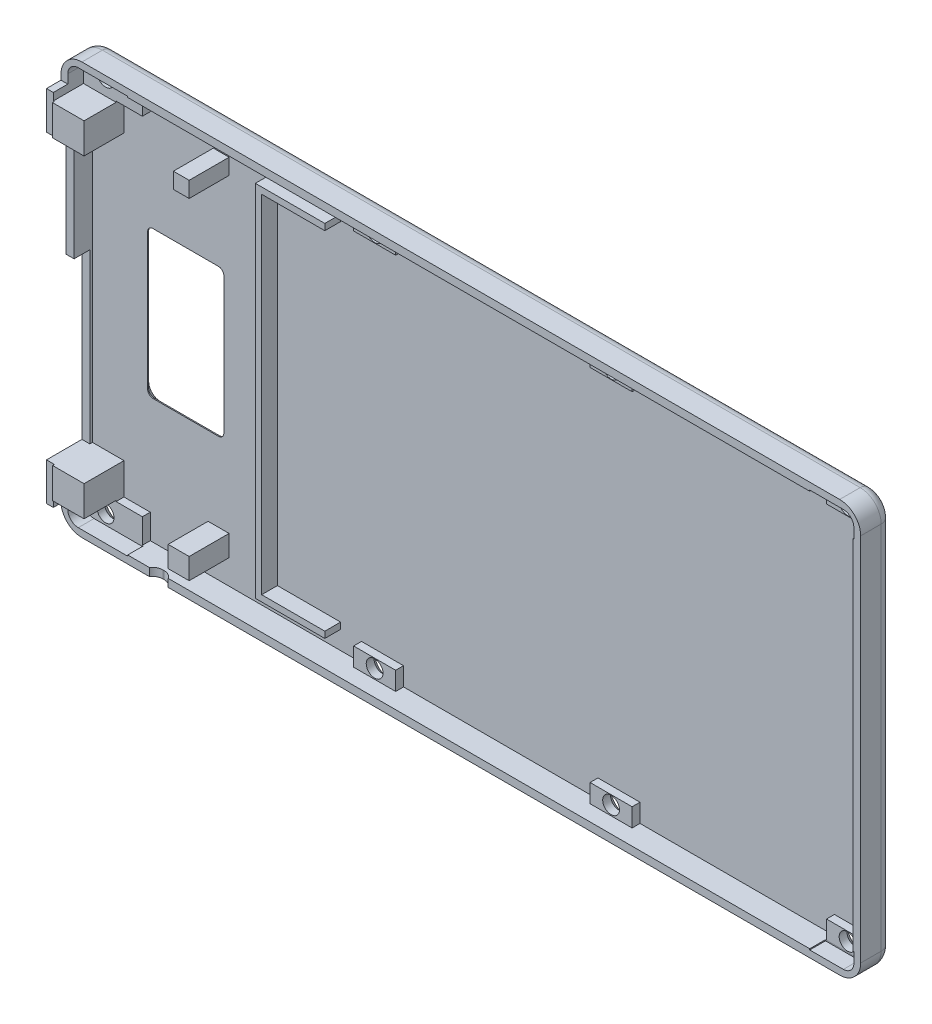
from build123d import *

# Parameters (mm, degrees)
BOSS_EXTRU_1_DEPTH            = 5.9
ESQUISSE1_4_W                 = 149.2
ESQUISSE1_4_H                 = 75.4
BOSS_EXTRU_2_DEPTH            = 1.4
BOSS_EXTRU_5_START            = 1.4
ESQUISSE1_5_W                 = 8
ESQUISSE1_5_H                 = 3.5
ESQUISSE1_5_R                 = 1.25
BOSS_EXTRU_5_DEPTH            = 1.5
BOSS_EXTRU_5_2_DEPTH          = 1.5
BOSS_EXTRU_5_3_DEPTH          = 1.5
BOSS_EXTRU_5_4_DEPTH          = 1.5
BOSS_EXTRU_5_5_DEPTH          = 1.5
BOSS_EXTRU_5_6_DEPTH          = 1.5
BOSS_EXTRU_7_START            = 1.4
BOSS_EXTRU_7_DEPTH            = 3
CONG_1_R                      = 4
CONG_2_R                      = 2
ENL_V_MAT_EXTRU_2_DEPTH       = 4.3
ENL_V_MAT_EXTRU_2_DEPTH_BACK  = 60.5
ESQUISSE4_R                   = 1.6
BOSS_EXTRU_9_START            = 1.4
ESQUISSE1_9_W                 = 6
ESQUISSE1_9_H                 = 6
ESQUISSE1_9_W_2               = 4
ESQUISSE1_9_H_2               = 4
ESQUISSE1_9_W_3               = 3
ESQUISSE1_9_H_3               = 3
BOSS_EXTRU_9_DEPTH            = 7.6
ESQUISSE5_W                   = 11
ESQUISSE5_H                   = 4.7
BOSS_EXTRU_10_DEPTH           = 1.5
ESQUISSE6_R                   = 1.6
ENL_V_MAT_EXTRU_3_DEPTH       = 40
CHANFREIN3_SIZE               = 1.48
ENL_V_MAT_EXTRU_6_DEPTH       = 1.4
ENL_V_MAT_EXTRU_7_DEPTH       = 3
CHANFREIN4_SIZE               = 1.2
CONG_3_R                      = 2
ESQUISSE11_W                  = 1.5
ESQUISSE11_H                  = 7.2
BOSS_EXTRU_11_DEPTH           = 2.75
ESQUISSE12_W                  = 1.5
ESQUISSE12_H                  = 32
ENL_V_MAT_EXTRU_8_DEPTH       = 4
ESQUISSE13_W                  = 1.5
ESQUISSE13_H                  = 22
ENL_V_MAT_EXTRU_9_DEPTH       = 1
ESQUISSE16_W                  = 101.979164715
ESQUISSE16_H                  = 1.2
ENL_V_MAT_EXTRU_11_DEPTH      = 3
ENL_V_MAT_EXTRU_10_DEPTH      = 5.7
ENL_V_MAT_EXTRU_10_DEPTH_BACK = 5.75


with BuildPart() as part:
    # Esquisse1 → Boss.-Extru.1 (new body)
    with BuildSketch(Plane.XY):
        Polygon((149.2, 75.4), (149.2, 71.9), (149.2, 70.7), (149.2, 37.7), (150.7, 37.7), (150.7, 76.9), (-1.5, 76.9), (-1.5, 37.7), (0, 37.7), (0, 64.7), (0, 70.7), (0, 72.1), (0, 75.4), (51.2, 75.4), (59.2, 75.4), (96.2, 75.4), (104.2, 75.4), (141.2, 75.4), align=None)
        Polygon((150.7, 37.7), (149.2, 37.7), (149.2, 4.7), (149.2, 3.5), (149.2, 0), (141.2, 0), (104.2, 0), (96.2, 0), (59.2, 0), (51.2, 0), (0, 0), (0, 3.3), (0, 4.7), (0, 10.7), (0, 37.7), (-1.5, 37.7), (-1.5, -1.5), (150.7, -1.5), align=None)
    extrude(amount=BOSS_EXTRU_1_DEPTH)

    # Esquisse1<4> → Boss.-Extru.2 (add)
    with BuildSketch(Plane.XY):
        with Locations((74.6, 37.7)):
            Rectangle(ESQUISSE1_4_W, ESQUISSE1_4_H)
    extrude(amount=BOSS_EXTRU_2_DEPTH)

    # Esquisse1<6> → Boss.-Extru.7 (add)
    with BuildSketch(Plane.XY.offset(BOSS_EXTRU_7_START)):
        Polygon((149.2, 70.7), (149.2, 71.9), (141.2, 71.9), (104.2, 71.9), (96.2, 71.9), (59.2, 71.9), (51.2, 71.9), (34, 71.9), (34, 37.7), (35.2, 37.7), (35.2, 70.7), align=None)
        Polygon((149.2, 3.5), (149.2, 4.7), (35.2, 4.7), (35.2, 37.7), (34, 37.7), (34, 3.5), (51.2, 3.5), (59.2, 3.5), (96.2, 3.5), (104.2, 3.5), (141.2, 3.5), align=None)
    extrude(amount=BOSS_EXTRU_7_DEPTH)

    # Congé1
    cong_1_edges = [part.edges().sort_by_distance(p)[0] for p in [
        (-1.5, 76.9, 2.95),
        (150.7, 76.9, 2.95),
        (150.7, -1.5, 2.95),
        (-1.5, -1.5, 2.95),
    ]]
    fillet(cong_1_edges, radius=CONG_1_R)

    # Congé2
    cong_2_edges = [part.edges().sort_by_distance(p)[0] for p in [
        (149.2, 0, 3.65),
        (149.2, 75.4, 3.65),
        (0, 75.4, 3.65),
        (0, 0, 3.65),
    ]]
    fillet(cong_2_edges, radius=CONG_2_R)


with BuildPart() as body_2:
    # Esquisse1<5> → Boss.-Extru.5 (new body)
    with BuildSketch(Plane.XY.offset(BOSS_EXTRU_5_START)):
        with Locations((145.2, 73.65)):
            Rectangle(ESQUISSE1_5_W, ESQUISSE1_5_H)
        with Locations(Location((145.2, 73.6, 0), (0, 0, 180))):
            Circle(ESQUISSE1_5_R, mode=Mode.SUBTRACT)
    extrude(amount=BOSS_EXTRU_5_DEPTH)


with BuildPart() as body_3:
    # Esquisse1<5> → Boss.-Extru.5 2 (new body)
    with BuildSketch(Plane.XY.offset(BOSS_EXTRU_5_START)):
        with Locations((100.2, 73.65)):
            Rectangle(ESQUISSE1_5_W, ESQUISSE1_5_H)
        with Locations(Location((100.2, 73.6, 0), (0, 0, 180))):
            Circle(ESQUISSE1_5_R, mode=Mode.SUBTRACT)
    extrude(amount=BOSS_EXTRU_5_2_DEPTH)


with BuildPart() as body_4:
    # Esquisse1<5> → Boss.-Extru.5 3 (new body)
    with BuildSketch(Plane.XY.offset(BOSS_EXTRU_5_START)):
        with Locations((145.2, 1.75)):
            Rectangle(ESQUISSE1_5_W, ESQUISSE1_5_H)
        with Locations(Location((145.2, 1.8, 0), (0, 0, 180))):
            Circle(ESQUISSE1_5_R, mode=Mode.SUBTRACT)
    extrude(amount=BOSS_EXTRU_5_3_DEPTH)


with BuildPart() as body_5:
    # Esquisse1<5> → Boss.-Extru.5 4 (new body)
    with BuildSketch(Plane.XY.offset(BOSS_EXTRU_5_START)):
        with Locations((55.2, 73.65)):
            Rectangle(ESQUISSE1_5_W, ESQUISSE1_5_H)
        with Locations(Location((55.2, 73.6, 0), (0, 0, 180))):
            Circle(ESQUISSE1_5_R, mode=Mode.SUBTRACT)
    extrude(amount=BOSS_EXTRU_5_4_DEPTH)


with BuildPart() as body_6:
    # Esquisse1<5> → Boss.-Extru.5 5 (new body)
    with BuildSketch(Plane.XY.offset(BOSS_EXTRU_5_START)):
        with Locations((100.2, 1.75)):
            Rectangle(ESQUISSE1_5_W, ESQUISSE1_5_H)
        with Locations(Location((100.2, 1.8, 0), (0, 0, 180))):
            Circle(ESQUISSE1_5_R, mode=Mode.SUBTRACT)
    extrude(amount=BOSS_EXTRU_5_5_DEPTH)


with BuildPart() as body_7:
    # Esquisse1<5> → Boss.-Extru.5 6 (new body)
    with BuildSketch(Plane.XY.offset(BOSS_EXTRU_5_START)):
        with Locations((55.2, 1.75)):
            Rectangle(ESQUISSE1_5_W, ESQUISSE1_5_H)
        with Locations(Location((55.2, 1.8, 0), (0, 0, 180))):
            Circle(ESQUISSE1_5_R, mode=Mode.SUBTRACT)
    extrude(amount=BOSS_EXTRU_5_6_DEPTH)


with BuildPart() as enl_v_mat_extru_2_tool:
    # Esquisse4 → Enlèv. mat.-Extru.2 (new, two sides: drawn at the far end of the back side and taken through both)
    with BuildSketch(Plane(origin=(0, 0, 0), x_dir=(-1, 0, 0), z_dir=(0, 0, -1)).offset(-ENL_V_MAT_EXTRU_2_DEPTH_BACK)):
        with Locations(Location((-55.2, 1.8, 0), (0, 0, 180))):
            Circle(ESQUISSE4_R)
        with Locations(Location((-100.2, 1.8, 0), (0, 0, 180))):
            Circle(ESQUISSE4_R)
        with Locations(Location((-145.2, 1.8, 0), (0, 0, 180))):
            Circle(ESQUISSE4_R)
        with Locations(Location((-145.2, 73.6, 0), (0, 0, 180))):
            Circle(ESQUISSE4_R)
        with Locations(Location((-100.2, 73.6, 0), (0, 0, 180))):
            Circle(ESQUISSE4_R)
        with Locations(Location((-55.2, 73.6, 0), (0, 0, 180))):
            Circle(ESQUISSE4_R)
    extrude(amount=ENL_V_MAT_EXTRU_2_DEPTH + ENL_V_MAT_EXTRU_2_DEPTH_BACK)


with BuildPart() as part_1:
    add(part.part)

    # Enlèv. mat.-Extru.2: cut by enl_v_mat_extru_2_tool
    add(enl_v_mat_extru_2_tool.part, mode=Mode.SUBTRACT)

    # Esquisse1<9> → Boss.-Extru.9 (add)
    with BuildSketch(Plane.XY.offset(BOSS_EXTRU_9_START)):
        with Locations((3, 7.7)):
            Rectangle(ESQUISSE1_9_W, ESQUISSE1_9_H)
        with Locations((24, 6.7)):
            Rectangle(ESQUISSE1_9_W_2, ESQUISSE1_9_H_2)
        with Locations((3, 67.7)):
            Rectangle(ESQUISSE1_9_W, ESQUISSE1_9_H)
        with Locations((24.5, 69.2)):
            Rectangle(ESQUISSE1_9_W_3, ESQUISSE1_9_H_3)
    extrude(amount=BOSS_EXTRU_9_DEPTH)

    # Esquisse5 → Boss.-Extru.10 (add)
    with BuildSketch(Plane.XY.offset(1.4)):
        with Locations((5.5, 73.05)):
            Rectangle(ESQUISSE5_W, ESQUISSE5_H)
        with Locations((5.5, 2.35)):
            Rectangle(ESQUISSE5_W, ESQUISSE5_H)
    extrude(amount=BOSS_EXTRU_10_DEPTH)

    # Esquisse6 → Enlèv. mat.-Extru.3 (cut)
    with BuildSketch(Plane(origin=(0, 0, 0), x_dir=(-1, 0, 0), z_dir=(0, 0, -1))):
        with Locations((-4, 1.8)):
            Circle(ESQUISSE6_R)
        with Locations((-4, 73.6)):
            Circle(ESQUISSE6_R)
    extrude(amount=-ENL_V_MAT_EXTRU_3_DEPTH, mode=Mode.SUBTRACT)

    # Chanfrein3
    # the kernel refuses this chamfer: 1.48 mm, written as the material it takes off along each edge
    with BuildSketch(Plane(origin=(55.2, 1.8, 0), x_dir=(1, 0, 0), z_dir=(0, 1, 0))) as chanfrein3_piece_1:
        Polygon((1.6 + CHANFREIN3_SIZE, 0), (1.6, -CHANFREIN3_SIZE), (1.6, 0), align=None)
    revolve(axis=Axis((55.2, 1.8, 0), (0, 0, -1)), mode=Mode.SUBTRACT)
    with BuildSketch(Plane(origin=(100.2, 1.8, 0), x_dir=(1, 0, 0), z_dir=(0, 1, 0))) as chanfrein3_piece_2:
        Polygon((1.6 + CHANFREIN3_SIZE, 0), (1.6, -CHANFREIN3_SIZE), (1.6, 0), align=None)
    revolve(axis=Axis((100.2, 1.8, 0), (0, 0, -1)), mode=Mode.SUBTRACT)
    with BuildSketch(Plane(origin=(145.2, 1.8, 0), x_dir=(1, 0, 0), z_dir=(0, 1, 0))) as chanfrein3_piece_3:
        Polygon((1.6 + CHANFREIN3_SIZE, 0), (1.6, -CHANFREIN3_SIZE), (1.6, 0), align=None)
    revolve(axis=Axis((145.2, 1.8, 0), (0, 0, -1)), mode=Mode.SUBTRACT)
    with BuildSketch(Plane(origin=(145.2, 73.6, 0), x_dir=(1, 0, 0), z_dir=(0, 1, 0))) as chanfrein3_piece_4:
        Polygon((1.6 + CHANFREIN3_SIZE, 0), (1.6, -CHANFREIN3_SIZE), (1.6, 0), align=None)
    revolve(axis=Axis((145.2, 73.6, 0), (0, 0, -1)), mode=Mode.SUBTRACT)
    with BuildSketch(Plane(origin=(100.2, 73.6, 0), x_dir=(1, 0, 0), z_dir=(0, 1, 0))) as chanfrein3_piece_5:
        Polygon((1.6 + CHANFREIN3_SIZE, 0), (1.6, -CHANFREIN3_SIZE), (1.6, 0), align=None)
    revolve(axis=Axis((100.2, 73.6, 0), (0, 0, -1)), mode=Mode.SUBTRACT)
    with BuildSketch(Plane(origin=(55.2, 73.6, 0), x_dir=(1, 0, 0), z_dir=(0, 1, 0))) as chanfrein3_piece_6:
        Polygon((1.6 + CHANFREIN3_SIZE, 0), (1.6, -CHANFREIN3_SIZE), (1.6, 0), align=None)
    revolve(axis=Axis((55.2, 73.6, 0), (0, 0, -1)), mode=Mode.SUBTRACT)
    with BuildSketch(Plane(origin=(4, 1.8, 0), x_dir=(-1, 0, 0), z_dir=(0, -1, 0))) as chanfrein3_piece_7:
        Polygon((1.6 + CHANFREIN3_SIZE, 0), (1.6, -CHANFREIN3_SIZE), (1.6, 0), align=None)
    revolve(axis=Axis((4, 1.8, 0), (0, 0, -1)), mode=Mode.SUBTRACT)
    with BuildSketch(Plane(origin=(4, 73.6, 0), x_dir=(-1, 0, 0), z_dir=(0, -1, 0))) as chanfrein3_piece_8:
        Polygon((1.6 + CHANFREIN3_SIZE, 0), (1.6, -CHANFREIN3_SIZE), (1.6, 0), align=None)
    revolve(axis=Axis((4, 73.6, 0), (0, 0, -1)), mode=Mode.SUBTRACT)

    # Esquisse9 → Enlèv. mat.-Extru.6 (cut)
    with BuildSketch(Plane(origin=(0, 0, 0), x_dir=(-1, 0, 0), z_dir=(0, 0, -1))):
        with BuildLine():
            Line((-11.5, 23.7), (-24, 23.7))
            ThreePointArc((-24, 23.7), (-24.707106781, 23.992893219), (-25, 24.7))
            Line((-25, 24.7), (-25, 50.7))
            ThreePointArc((-25, 50.7), (-24.707106781, 51.407106781), (-24, 51.7))
            Line((-24, 51.7), (-11.5, 51.7))
            ThreePointArc((-11.5, 51.7), (-10.792893219, 51.407106781), (-10.5, 50.7))
            Line((-10.5, 50.7), (-10.5, 24.7))
            ThreePointArc((-10.5, 24.7), (-10.792893219, 23.992893219), (-11.5, 23.7))
        make_face()
    extrude(amount=-ENL_V_MAT_EXTRU_6_DEPTH, mode=Mode.SUBTRACT)

    # Esquisse10 → Enlèv. mat.-Extru.7 (cut)
    with BuildSketch(Plane.XZ.offset(1.5)):
        with BuildLine():
            Line((17.25, 9.25), (17, 9.25))
            ThreePointArc((17, 9.25), (15.585786438, 8.664213562), (15, 7.25))
            Line((15, 7.25), (15, 7))
            ThreePointArc((15, 7), (15.585786438, 5.585786438), (17, 5))
            Line((17, 5), (17.25, 5))
            ThreePointArc((17.25, 5), (18.664213562, 5.585786438), (19.25, 7))
            Line((19.25, 7), (19.25, 7.25))
            ThreePointArc((19.25, 7.25), (18.664213562, 8.664213562), (17.25, 9.25))
        make_face()
    extrude(amount=-ENL_V_MAT_EXTRU_7_DEPTH, mode=Mode.SUBTRACT)

    # Chanfrein4
    chanfrein4_edges = [part_1.edges().sort_by_distance(p)[0] for p in [
        (10.792893219, 51.407106781, 0),
        (17.75, 51.7, 0),
        (24.707106781, 51.407106781, 0),
        (25, 37.7, 0),
        (24.707106781, 23.992893219, 0),
        (17.75, 23.7, 0),
        (10.792893219, 23.992893219, 0),
        (10.5, 37.7, 0),
    ]]
    chamfer(chanfrein4_edges, length=CHANFREIN4_SIZE)

    # Congé3
    # the kernel refuses this fillet: 2 mm, written as the material it takes off along each edge
    with BuildSketch(Plane(origin=(-1.5, 2.5, 0), x_dir=(1, 0, 0), z_dir=(0, 1, 0)), Plane(origin=(150.7, 72.9, 0), x_dir=(-1, 0, 0), z_dir=(0, -1, 0))) as cong_3_piece_1:
        with BuildLine():
            CenterArc((CONG_3_R, -CONG_3_R), CONG_3_R, 90, 90)
            Line((0, -CONG_3_R), (0, 0))
            Line((0, 0), (CONG_3_R, 0))
        make_face()
    extrude(amount=70.4, mode=Mode.SUBTRACT)
    with BuildSketch(Plane(origin=(146.7, 76.9, 0), x_dir=(0, -1, 0), z_dir=(-1, 0, 0)), Plane(origin=(2.5, -1.5, 0), x_dir=(0, 1, 0), z_dir=(1, 0, 0))) as cong_3_piece_2:
        with BuildLine():
            CenterArc((CONG_3_R, CONG_3_R), CONG_3_R, 180, 90)
            Line((0, CONG_3_R), (0, 0))
            Line((0, 0), (CONG_3_R, 0))
        make_face()
    extrude(amount=144.2, mode=Mode.SUBTRACT)
    with BuildSketch(Plane(origin=(146.7, 72.9, 0), x_dir=(0, 1, 0), z_dir=(-1, 0, 0))) as cong_3_piece_3:
        with BuildLine():
            CenterArc((4 - CONG_3_R, -CONG_3_R), CONG_3_R, 0, 90)
            Line((4, -CONG_3_R), (4, 0))
            Line((4, 0), (4 - CONG_3_R, 0))
        make_face()
    revolve(axis=Axis((146.7, 72.9, 0), (0, 0, -1)), revolution_arc=90, mode=Mode.SUBTRACT)
    with BuildSketch(Plane(origin=(146.7, 2.5, 0), x_dir=(0, -1, 0), z_dir=(-1, 0, 0))) as cong_3_piece_4:
        with BuildLine():
            CenterArc((4 - CONG_3_R, CONG_3_R), CONG_3_R, 270, 90)
            Line((4, CONG_3_R), (4, 0))
            Line((4, 0), (4 - CONG_3_R, 0))
        make_face()
    revolve(axis=Axis((146.7, 2.5, 0), (0, 0, 1)), revolution_arc=90, mode=Mode.SUBTRACT)
    with BuildSketch(Plane(origin=(2.5, 2.5, 0), x_dir=(-1, 0, 0), z_dir=(0, 1, 0))) as cong_3_piece_5:
        with BuildLine():
            CenterArc((4 - CONG_3_R, CONG_3_R), CONG_3_R, 270, 90)
            Line((4, CONG_3_R), (4, 0))
            Line((4, 0), (4 - CONG_3_R, 0))
        make_face()
    revolve(axis=Axis((2.5, 2.5, 0), (0, 0, 1)), revolution_arc=90, mode=Mode.SUBTRACT)
    with BuildSketch(Plane(origin=(2.5, 72.9, 0), x_dir=(0, 1, 0), z_dir=(1, 0, 0))) as cong_3_piece_6:
        with BuildLine():
            CenterArc((4 - CONG_3_R, CONG_3_R), CONG_3_R, 270, 90)
            Line((4, CONG_3_R), (4, 0))
            Line((4, 0), (4 - CONG_3_R, 0))
        make_face()
    revolve(axis=Axis((2.5, 72.9, 0), (0, 0, 1)), revolution_arc=90, mode=Mode.SUBTRACT)

    # Esquisse11 → Boss.-Extru.11 (add)
    with BuildSketch(Plane.XY.offset(5.9)):
        with Locations((-0.75, 68.3)):
            Rectangle(ESQUISSE11_W, ESQUISSE11_H)
        with Locations((-0.75, 7.1)):
            Rectangle(ESQUISSE11_W, ESQUISSE11_H)
    extrude(amount=BOSS_EXTRU_11_DEPTH)

    # Esquisse12 → Enlèv. mat.-Extru.8 (cut)
    with BuildSketch(Plane.XY.offset(5.9)):
        with Locations((-0.75, 26.7)):
            Rectangle(ESQUISSE12_W, ESQUISSE12_H)
    extrude(amount=-ENL_V_MAT_EXTRU_8_DEPTH, mode=Mode.SUBTRACT)

    # Esquisse13 → Enlèv. mat.-Extru.9 (cut)
    with BuildSketch(Plane.XY.offset(5.9)):
        with Locations((-0.75, 53.7)):
            Rectangle(ESQUISSE13_W, ESQUISSE13_H)
    extrude(amount=-ENL_V_MAT_EXTRU_9_DEPTH, mode=Mode.SUBTRACT)

    # Esquisse16 → Enlèv. mat.-Extru.11 (cut)
    with BuildSketch(Plane.XY.offset(4.4)):
        with Locations((98.210417643, 71.3)):
            Rectangle(ESQUISSE16_W, ESQUISSE16_H)
        with Locations((98.210417643, 4.1)):
            Rectangle(ESQUISSE16_W, ESQUISSE16_H)
    extrude(amount=-ENL_V_MAT_EXTRU_11_DEPTH, mode=Mode.SUBTRACT)

    # Esquisse14 → Enlèv. mat.-Extru.10 (cut, two sides: drawn at the far end of the back side and taken through both)
    with BuildSketch(Plane.XY.offset(8.65).offset(-ENL_V_MAT_EXTRU_10_DEPTH_BACK)):
        with BuildLine():
            Line((-0.2, 4.9), (11.2, 4.9))
            Line((11.2, 4.9), (11.2, -0.2))
            Line((11.2, -0.2), (1.8, -0.2))
            ThreePointArc((1.8, -0.2), (0.385786438, 0.385786438), (-0.2, 1.8))
            Line((-0.2, 1.8), (-0.2, 4.9))
        make_face()
        with BuildLine():
            Line((-0.2, 70.5), (11.2, 70.5))
            Line((11.2, 70.5), (11.2, 75.6))
            Line((11.2, 75.6), (1.8, 75.6))
            ThreePointArc((1.8, 75.6), (0.385786438, 75.014213562), (-0.2, 73.6))
            Line((-0.2, 73.6), (-0.2, 70.5))
        make_face()
        with BuildLine():
            Line((141, 75.6), (141, 71.7))
            Line((141, 71.7), (149.4, 71.7))
            Line((149.4, 71.7), (149.4, 73.6))
            ThreePointArc((149.4, 73.6), (148.814213562, 75.014213562), (147.4, 75.6))
            Line((147.4, 75.6), (141, 75.6))
        make_face()
        with BuildLine():
            Line((141, -0.2), (147.4, -0.2))
            ThreePointArc((147.4, -0.2), (148.814213562, 0.385786438), (149.4, 1.8))
            Line((149.4, 1.8), (149.4, 3.7))
            Line((149.4, 3.7), (141, 3.7))
            Line((141, 3.7), (141, -0.2))
        make_face()
    extrude(amount=ENL_V_MAT_EXTRU_10_DEPTH + ENL_V_MAT_EXTRU_10_DEPTH_BACK, mode=Mode.SUBTRACT)


with BuildPart() as body_2_1:
    add(body_2.part)

    # Enlèv. mat.-Extru.2: cut by enl_v_mat_extru_2_tool
    add(enl_v_mat_extru_2_tool.part, mode=Mode.SUBTRACT)


with BuildPart() as body_3_1:
    add(body_3.part)

    # Enlèv. mat.-Extru.2: cut by enl_v_mat_extru_2_tool
    add(enl_v_mat_extru_2_tool.part, mode=Mode.SUBTRACT)


with BuildPart() as body_4_1:
    add(body_4.part)

    # Enlèv. mat.-Extru.2: cut by enl_v_mat_extru_2_tool
    add(enl_v_mat_extru_2_tool.part, mode=Mode.SUBTRACT)


with BuildPart() as body_5_1:
    add(body_5.part)

    # Enlèv. mat.-Extru.2: cut by enl_v_mat_extru_2_tool
    add(enl_v_mat_extru_2_tool.part, mode=Mode.SUBTRACT)


with BuildPart() as body_6_1:
    add(body_6.part)

    # Enlèv. mat.-Extru.2: cut by enl_v_mat_extru_2_tool
    add(enl_v_mat_extru_2_tool.part, mode=Mode.SUBTRACT)


with BuildPart() as body_7_1:
    add(body_7.part)

    # Enlèv. mat.-Extru.2: cut by enl_v_mat_extru_2_tool
    add(enl_v_mat_extru_2_tool.part, mode=Mode.SUBTRACT)


solid = Compound([part_1.part, body_2_1.part, body_3_1.part, body_4_1.part, body_5_1.part, body_6_1.part, body_7_1.part])
